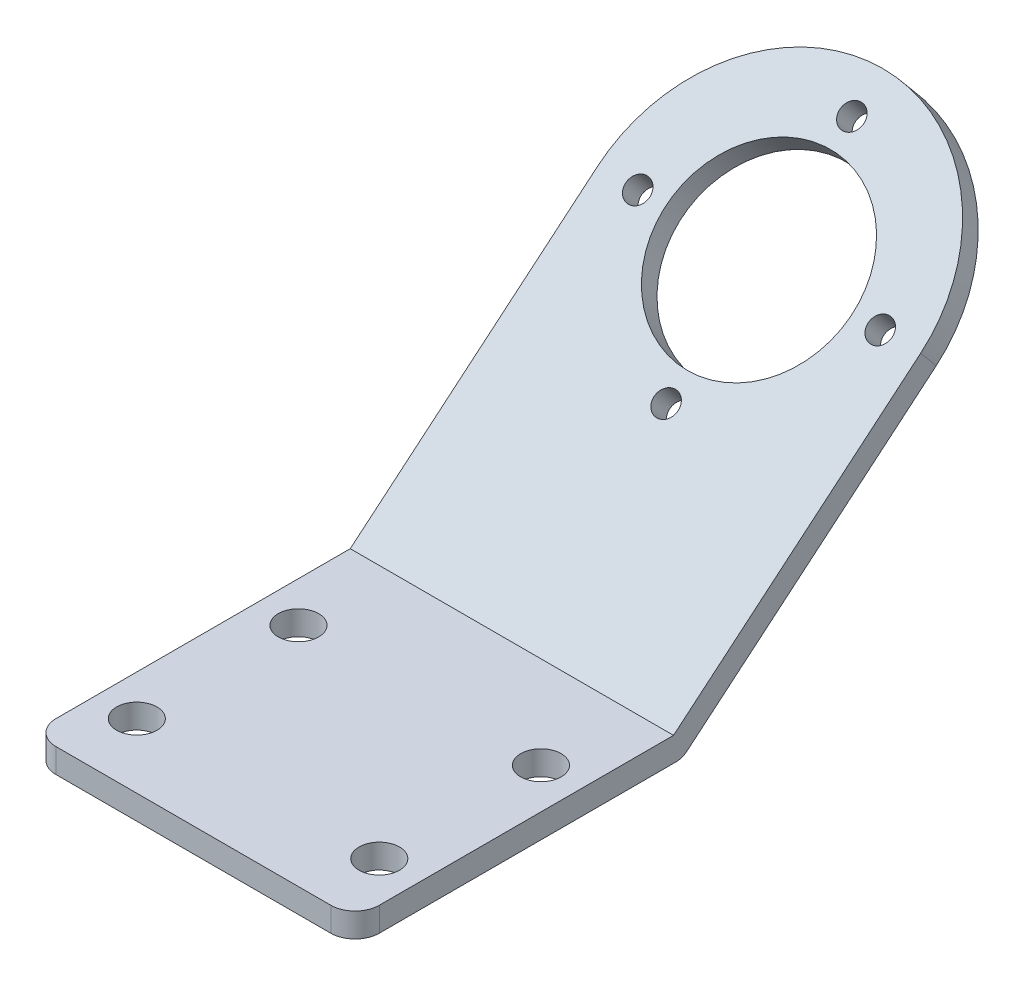
from build123d import *

# Parameters (mm, degrees)
EXTRUDE_1_DEPTH     = 40
SKETCH_3_R          = 2.5
SKETCH_3_R_2        = 2.499999999
CUT_EXTRUDE_1_DEPTH = 40
FILLET_1_R          = 3
FILLET_2_R          = 3
FILLET_3_R          = 20
FILLET_4_R          = 20
SKETCH_4_R          = 11.55
SKETCH_4_R_2        = 1.5
CUT_EXTRUDE_2_DEPTH = 40
FILLET_5_R          = 2


with BuildPart() as part:
    # 草图1 → 凸台-拉伸1 (new body)
    with BuildSketch(Plane(origin=(0, 0, 0), x_dir=(0, 0, -1), z_dir=(1, 0, 0))):
        Polygon((-39.408089297, 0), (0, 0), (45.892258904, 38.50817752), (47.820621733, 36.210044191), (1.091910703, -3), (0.178974486, -3), (-39.408089297, -3), align=None)
    extrude(amount=EXTRUDE_1_DEPTH)

    # 草图3 → 切除-拉伸1 (cut)
    with BuildSketch(Plane(origin=(0, 0, 0), x_dir=(1, 0, 0), z_dir=(0, 1, 0))):
        with Locations(Location((5, -31.408089297, 0), (0, 0, 270))):
            Circle(SKETCH_3_R)
        with Locations(Location((5, -11.408089297, 0), (0, 0, 270))):
            Circle(SKETCH_3_R_2)
        with Locations(Location((35, -11.408089297, 0), (0, 0, 270))):
            Circle(SKETCH_3_R_2)
        with Locations(Location((35, -31.408089297, 0), (0, 0, 270))):
            Circle(SKETCH_3_R)
    extrude(amount=-CUT_EXTRUDE_1_DEPTH, mode=Mode.SUBTRACT)

    # 圆角1
    fillet_1_edges = [part.edges().sort_by_distance(p)[0] for p in [
        (40, -1.5, 39.408089297),
    ]]
    fillet(fillet_1_edges, radius=FILLET_1_R)

    # 圆角2
    fillet_2_edges = [part.edges().sort_by_distance(p)[0] for p in [
        (0, -1.5, 39.408089297),
    ]]
    fillet(fillet_2_edges, radius=FILLET_2_R)

    # 圆角3
    fillet_3_edges = [part.edges().sort_by_distance(p)[0] for p in [
        (0, 37.359110856, -46.856440319),
    ]]
    fillet(fillet_3_edges, radius=FILLET_3_R)

    # 圆角4
    fillet_4_edges = [part.edges().sort_by_distance(p)[0] for p in [
        (40, 37.359110856, -46.856440319),
    ]]
    fillet(fillet_4_edges, radius=FILLET_4_R - 0.0001)  # a hair under: the kernel refuses the full size

    # 草图4 → 切除-拉伸2 (cut)
    with BuildSketch(Plane(origin=(0, 0, 0), x_dir=(1, 0, 0), z_dir=(0, 0.7660444431189773, 0.6427876096865403))):
        with Locations(Location((20, 39.908089297, 0), (0, 0, 270))):
            Circle(SKETCH_4_R)
        with Locations(Location((20, 54.908089297, 0), (0, 0, 270))):
            Circle(SKETCH_4_R_2)
        with Locations(Location((35, 39.908089297, 0), (0, 0, 270))):
            Circle(SKETCH_4_R_2)
        with Locations(Location((5, 39.908089297, 0), (0, 0, 270))):
            Circle(SKETCH_4_R_2)
        with Locations(Location((20, 24.908089297, 0), (0, 0, 270))):
            Circle(SKETCH_4_R_2)
    extrude(amount=-CUT_EXTRUDE_2_DEPTH, mode=Mode.SUBTRACT)

    # 圆角5
    fillet_5_edges = [part.edges().sort_by_distance(p)[0] for p in [
        (20, -3, -1.091910703),
    ]]
    fillet(fillet_5_edges, radius=FILLET_5_R)


solid = part.part
